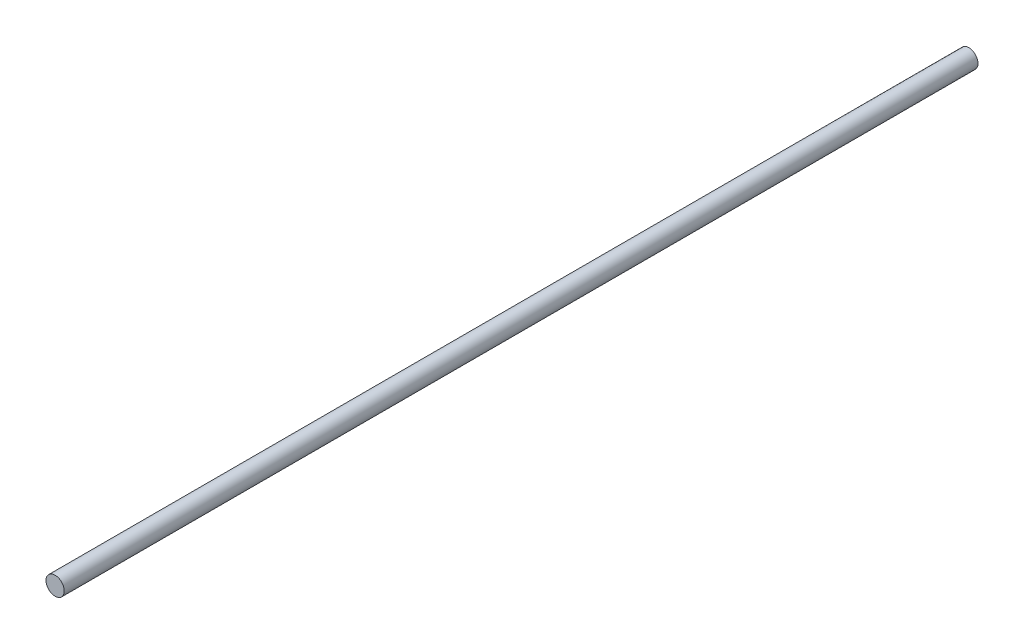
from build123d import *

# Parameters (mm, degrees)
SKETCH1_R           = 4
BOSS_EXTRUDE1_DEPTH = 200


with BuildPart() as part:
    # Sketch1 → Boss-Extrude1 (new, symmetric)
    with BuildSketch(Plane.XY):
        Circle(SKETCH1_R)
    extrude(amount=BOSS_EXTRUDE1_DEPTH, both=True)


solid = part.part
